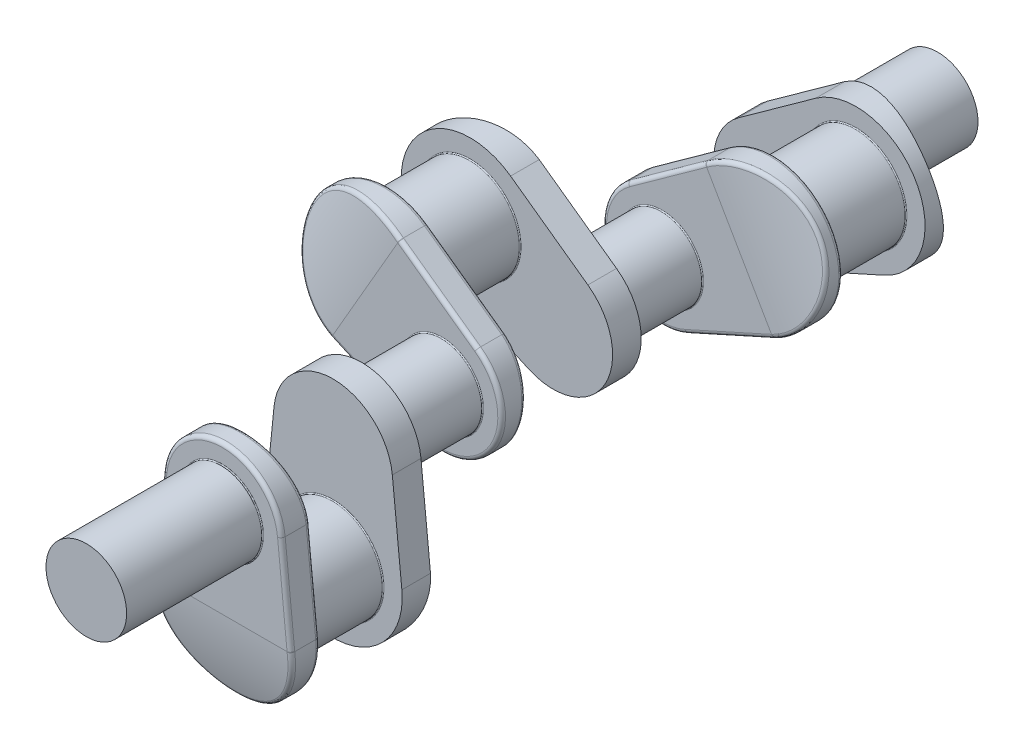
from build123d import *
from build123d.topology import SkipClean

# Parameters (mm, degrees)
SKETCH1_R             = 33.1
BOSS_EXTRUDE1_DEPTH   = 27.31
BOSS_EXTRUDE2_DEPTH   = 19
SKETCH3_R             = 26.75
BOSS_EXTRUDE3_DEPTH   = 26.67
CUT_EXTRUDE1_DEPTH    = 78.36
CUT_EXTRUDE2_DEPTH    = 78.36
FILLET1_R             = 2.54
FILLET2_R             = 0.64
FILLET2_OF_MIRROR2_R  = 0.64
LPATTERN1_COUNT       = 3
LPATTERN1_PITCH       = 145.96
BODY_MOVE_COPY1_ANGLE = 120
BODY_MOVE_COPY2_ANGLE = 120
SKETCH6_R             = 26.75
BOSS_EXTRUDE4_DEPTH   = 63.5
BOSS_EXTRUDE5_START   = 63.5
SKETCH7_R             = 26.75
BOSS_EXTRUDE5_DEPTH   = 63.5


with BuildPart() as part:
    # Sketch1 → Boss-Extrude1 (new body)
    with BuildSketch(Plane.XY):
        Circle(SKETCH1_R)
    boss_extrude1 = extrude(amount=BOSS_EXTRUDE1_DEPTH)

    # Sketch2 → Boss-Extrude2 (add)
    with BuildSketch(Plane.XY.offset(27.31)):
        with BuildLine():
            Line((-39.252254394, 67.445), (-45.570424619, 4.58))
            ThreePointArc((-45.570424619, 4.58), (0, -45.8), (45.570424619, 4.58))
            Line((45.570424619, 4.58), (39.252254394, 67.445))
            ThreePointArc((39.252254394, 67.445), (0, 102.95), (-39.252254394, 67.445))
        make_face()
    boss_extrude2 = extrude(amount=BOSS_EXTRUDE2_DEPTH)

    # Sketch3 → Boss-Extrude3 (add)
    with BuildSketch(Plane.XY.offset(46.31)):
        with Locations((0, 63.5)):
            Circle(SKETCH3_R)
    boss_extrude3 = extrude(amount=BOSS_EXTRUDE3_DEPTH)

    # Sketch4 → Cut-Extrude1 (cut, symmetric)
    with BuildSketch(Plane(origin=(0, 0, 0), x_dir=(0, 0, -1), z_dir=(1, 0, 0))):
        with BuildLine():
            Line((-46.31, 4.58), (-69.120375676, 4.58))
            Line((-69.120375676, 4.58), (-69.120375676, -45.8))
            Line((-69.120375676, -45.8), (-36.81, -45.8))
            ThreePointArc((-36.81, -45.8), (-43.481527064, -20.972336386), (-46.31, 4.58))
        make_face()
    cut_extrude1 = extrude(amount=CUT_EXTRUDE1_DEPTH, both=True, mode=Mode.SUBTRACT)

    # Sketch5 → Cut-Extrude2 (cut, symmetric)
    with BuildSketch(Plane(origin=(0, 0, 0), x_dir=(0, 0, -1), z_dir=(1, 0, 0))):
        with BuildLine():
            Line((-32.31, 102.95), (-13.345761104, 102.95))
            Line((-13.345761104, 102.95), (-13.345761104, 67.445))
            Line((-13.345761104, 67.445), (-27.31, 67.445))
            ThreePointArc((-27.31, 67.445), (-28.865735658, 85.330476249), (-32.31, 102.95))
        make_face()
    extrude(amount=CUT_EXTRUDE2_DEPTH, both=True, mode=Mode.SUBTRACT)

    # Fillet1
    fillet1_edges = [part.edges().sort_by_distance(p)[0] for p in [
        (42.411339507, 36.0125, 46.31),
        (-42.411339507, 36.0125, 46.31),
        (0, 102.95, 46.31),
        (-42.411339507, 36.0125, 27.31),
        (42.411339507, 36.0125, 27.31),
        (0, -45.8, 27.31),
        (33.977387655, -30.71118898, 41.345816714),
        (26.477599749, 92.744473216, 30.078437446),
    ]]
    fillet(fillet1_edges, radius=FILLET1_R)

    # Fillet2
    fillet2_edges = [part.edges().sort_by_distance(p)[0] for p in [
        (-33.1, 0, 27.31),
        (-26.75, 63.5, 46.31),
    ]]
    fillet(fillet2_edges, radius=FILLET2_R)

    # Mirror2: Boss-Extrude1, Boss-Extrude2, Boss-Extrude3, Cut-Extrude1 across plane
    add(boss_extrude1.mirror(Plane.XY))
    add(boss_extrude2.mirror(Plane.XY))
    add(boss_extrude3.mirror(Plane.XY))
    add(cut_extrude1.mirror(Plane.XY), mode=Mode.SUBTRACT)

    # Fillet2 of Mirror2
    fillet2_of_mirror2_edges = [part.edges().sort_by_distance(p)[0] for p in [
        (-33.1, 0, -27.31),
        (-26.75, 63.5, -46.31),
    ]]
    fillet(fillet2_of_mirror2_edges, radius=FILLET2_OF_MIRROR2_R)


with BuildPart() as lpattern1_1:
    # LPattern1: pattern copy
    add(part.part.moved(Location(Vector(0, 0, -1) * (1 * LPATTERN1_PITCH))))


with BuildPart() as lpattern1_2:
    # LPattern1: pattern copy
    add(part.part.moved(Location(Vector(0, 0, -1) * (2 * LPATTERN1_PITCH))))


with BuildPart() as lpattern1_1_1:
    # Body-Move/Copy1: moved
    add(lpattern1_1.part.rotate(Axis((0, 63.5, 0), (0, 0, -1)), BODY_MOVE_COPY1_ANGLE))


with BuildPart() as lpattern1_2_1:
    # Body-Move/Copy2: moved
    add(lpattern1_2.part.rotate(Axis((0, 63.5, 0), (0, 0, 1)), BODY_MOVE_COPY2_ANGLE))


with BuildPart() as part_1:
    add(part.part)

    # Combine4: union LPattern1_1, LPattern1_2
    add(lpattern1_1_1.part)
    add(lpattern1_2_1.part)

    # Sketch6 → Boss-Extrude4 (add)
    with SkipClean():  # the faces are left unmerged after this step: merging them gives an invalid solid
        with BuildSketch(Plane.XY.offset(72.98)):
            with Locations((0, 63.5)):
                Circle(SKETCH6_R)
        extrude(amount=BOSS_EXTRUDE4_DEPTH)

    # Sketch7 → Boss-Extrude5 (add)
    with SkipClean():  # the faces are left unmerged after this step: merging them gives an invalid solid
        with BuildSketch(Plane(origin=(0, 0, -364.9), x_dir=(-1, 0, 0), z_dir=(0, 0, -1)).offset(BOSS_EXTRUDE5_START)):
            with Locations((0, 63.5)):
                Circle(SKETCH7_R)
        extrude(amount=-BOSS_EXTRUDE5_DEPTH)


solid = part_1.part
